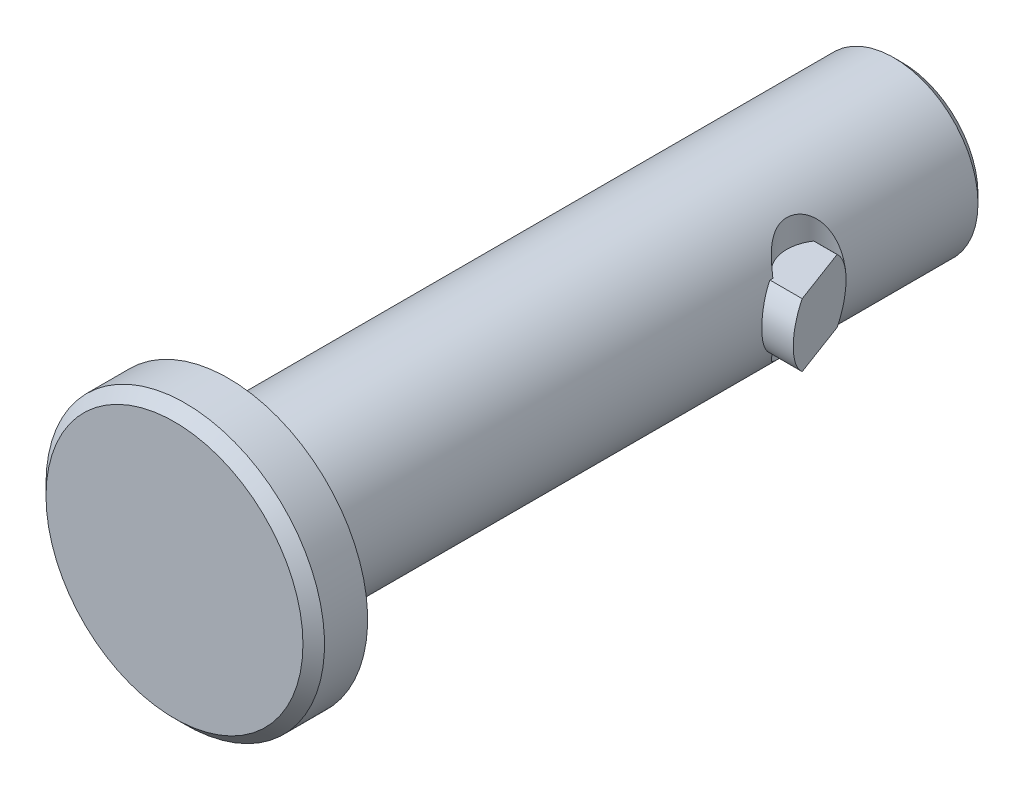
from build123d import *

# Parameters (mm, degrees)
SKETCH1_R               = 2.38125
EXTRUDE1_DEPTH          = 9.525
SKETCH2_R               = 3.937
EXTRUDE2_DEPTH          = 1.524
CHAMFER1_SIZE           = 0.3048
CHAMFER2_SIZE           = 0.238125
SKETCH3_R               = 1.190625
EXTRUDE5_DEPTH          = 3.27025
EXTRUDE6_DEPTH          = 13.372563962
EXTRUDE6_DEPTH_BACK     = 13.372563962
SKETCH11_W              = 2.38125
SKETCH11_H              = 1.48828125
EXTRUDE8_DEPTH          = 13.372563962
EXTRUDE7_DEPTH          = 13.372563962
EXTRUDE7_DEPTH_BACK     = 13.372563962
BODY_MOVE_COPY1_START   = -3
BODY_MOVE_COPY1_2_DEPTH = 6


with BuildPart() as part:
    # Sketch1 → Extrude1 (new, symmetric)
    with BuildSketch(Plane.XY):
        with Locations(Location((0, 0, 0), (0, 0, 180))):
            Circle(SKETCH1_R)
    extrude(amount=EXTRUDE1_DEPTH, both=True)

    # Sketch2 → Extrude2 (add)
    with BuildSketch(Plane.XY.offset(9.525)):
        with Locations(Location((0, 0, 0), (0, 0, 180))):
            Circle(SKETCH2_R)
    extrude(amount=EXTRUDE2_DEPTH)

    # Chamfer1
    chamfer1_edges = [part.edges().sort_by_distance(p)[0] for p in [
        (3.937, 0, 11.049),
    ]]
    chamfer(chamfer1_edges, length=CHAMFER1_SIZE)

    # Chamfer2
    chamfer2_edges = [part.edges().sort_by_distance(p)[0] for p in [
        (2.38125, 0, -9.525),
    ]]
    chamfer(chamfer2_edges, length=CHAMFER2_SIZE)

    # Sketch10 → Extrude7 (cut, two sides: drawn at the far end of the back side and taken through both)
    with BuildSketch(Plane(origin=(0, 0, 0), x_dir=(1, 0, 0), z_dir=(0, 1, 0)).offset(-EXTRUDE7_DEPTH_BACK)):
        with BuildLine():
            Line((2.38125, 5.55625), (2.38125, 3.578100586))
            ThreePointArc((2.38125, 3.578100586), (1.694749991, 4.567175293), (2.38125, 5.55625))
        make_face()
    extrude(amount=EXTRUDE7_DEPTH + EXTRUDE7_DEPTH_BACK, mode=Mode.SUBTRACT)


with BuildPart() as body_2:
    # Sketch3 → Extrude5 (new body)
    with BuildSketch(Plane(origin=(0, 0, 0), x_dir=(0, 0, -1), z_dir=(1, 0, 0))):
        with Locations(Location((4.365625, 0, 0), (0, 0, 180))):
            Circle(SKETCH3_R)
    extrude(amount=EXTRUDE5_DEPTH)

    # Sketch9 → Extrude6 (cut, two sides: drawn at the far end of the back side and taken through both)
    with BuildSketch(Plane(origin=(0, 0, 0), x_dir=(1, 0, 0), z_dir=(0, 1, 0)).offset(-EXTRUDE6_DEPTH_BACK)):
        Polygon((-13.544226274, 48.213775733), (2.38125, 5.55625), (3.27025, 3.175), (19.195726274, -39.482525733), (104.51077774, -7.631573186), (71.770825193, 80.064728281), align=None)
    extrude(amount=EXTRUDE6_DEPTH + EXTRUDE6_DEPTH_BACK, mode=Mode.SUBTRACT)

    # Sketch11 → Extrude8 (cut, through all)
    with BuildSketch(Plane(origin=(0, 0, 0), x_dir=(0, 0, -1), z_dir=(1, 0, 0))):
        with Locations((4.365625, 1.637109375)):
            Rectangle(SKETCH11_W, SKETCH11_H)
        with Locations((4.365625, -1.637109375)):
            Rectangle(SKETCH11_W, SKETCH11_H)
    extrude(amount=EXTRUDE8_DEPTH, mode=Mode.SUBTRACT)


with BuildPart() as body_3:
    # Body-Move/Copy1: read off the stored shape, not the designer's step
    # Body-Move/Copy1 outline → Body-Move/Copy1 (revolve)
    with BuildSketch(Plane.XZ):
        Polygon((0, 11.049), (0, -9.525), (2.143125, -9.525), (2.38125, -9.286875), (2.38125, 9.525), (3.937, 9.525), (3.937, 10.7442), (3.6322, 11.049), align=None)
    revolve(axis=Axis((0, 0, 0), (0, 0, 1)))

    # Body-Move_Copy1 2 outline → Body-Move_Copy1 2 (cut)
    with BuildSketch(Plane(origin=(0, 0, 0), x_dir=(1, 0, 0), z_dir=(0, 1, 0)).offset(BODY_MOVE_COPY1_START)):
        with BuildLine():
            Line((4, 6.160583018), (2.381250169, 5.556250063))
            ThreePointArc((2.381250169, 5.556250063), (1.694749991, 4.567175372), (2.381250021, 3.578100578))
            Line((2.381250021, 3.578100578), (4, 2.973767292))
            Line((4, 2.973767292), (4, 6.160583018))
        make_face()
    extrude(amount=BODY_MOVE_COPY1_2_DEPTH, mode=Mode.SUBTRACT)


with BuildPart() as body_2_1:
    add(body_2.part)

    # Combine1: cut body 3
    add(body_3.part, mode=Mode.SUBTRACT)


solid = Compound([part.part, body_2_1.part])
